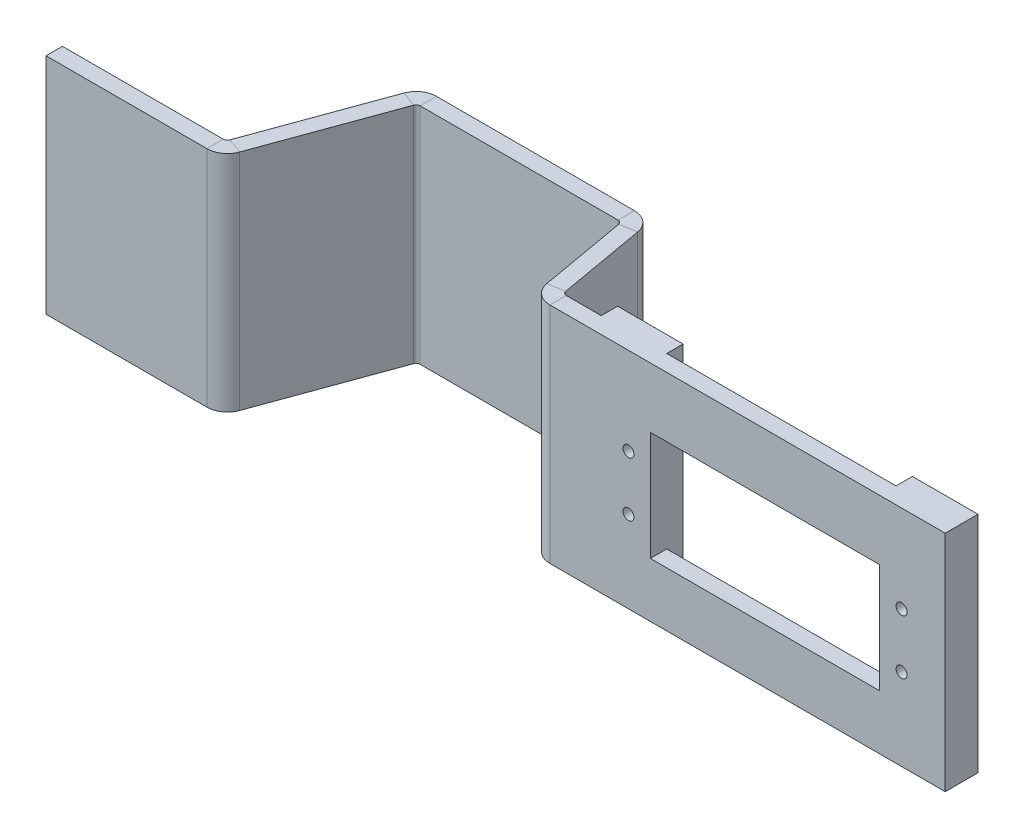
from build123d import *

# Parameters (mm, degrees)
BASE_FLANGE1_DEPTH  = 41
SKETCH2_W           = 42
SKETCH2_H           = 20
CUT_EXTRUDE1_DEPTH  = 10
BOSS_EXTRUDE1_DEPTH = 6
SKETCH5_R           = 1
CUT_EXTRUDE3_DEPTH  = 165.132308696


# Sheet-metal steps are written as plain solids
with BuildPart() as part:
    # Sketch1 → Base-Flange1 (new body)
    with BuildSketch(Plane(origin=(0, 0, 0), x_dir=(1, 0, 0), z_dir=(0, 1, 0))):
        with BuildLine():
            Line((0, 0), (29.484227127, 0))
            ThreePointArc((29.484227127, 0), (29.90672353, 0.133212604), (30.176404712, 0.484667962))
            Line((30.176404712, 0.484667962), (38.681704054, 23.85278585))
            ThreePointArc((38.681704054, 23.85278585), (40.049733788, 25.635636911), (42.1929595, 26.311393382))
            Line((42.1929595, 26.311393382), (78.441184331, 26.311393382))
            ThreePointArc((78.441184331, 26.311393382), (80.843024514, 25.437195048), (82.121016981, 23.223647163))
            Line((82.121016981, 23.223647163), (84.942198964, 7.223929074))
            ThreePointArc((84.942198964, 7.223929074), (85.194131001, 6.787569985), (85.667608355, 6.615238322))
            Line((85.667608355, 6.615238322), (158.049527566, 6.615238322))
            Line((158.049527566, 6.615238322), (158.049527566, 3.615238322))
            Line((158.049527566, 3.615238322), (85.667608355, 3.615238322))
            ThreePointArc((85.667608355, 3.615238322), (83.265768172, 4.489436656), (81.987775705, 6.702984541))
            Line((81.987775705, 6.702984541), (79.166593722, 22.70270263))
            ThreePointArc((79.166593722, 22.70270263), (78.914661685, 23.139061719), (78.441184331, 23.311393382))
            Line((78.441184331, 23.311393382), (42.1929595, 23.311393382))
            ThreePointArc((42.1929595, 23.311393382), (41.770463097, 23.178180778), (41.500781916, 22.82672542))
            Line((41.500781916, 22.82672542), (32.995482574, -0.541392468))
            ThreePointArc((32.995482574, -0.541392468), (31.627452839, -2.324243529), (29.484227127, -3))
            Line((29.484227127, -3), (0, -3))
            Line((0, -3), (0, 0))
        make_face()
    extrude(amount=BASE_FLANGE1_DEPTH)

    # Sketch2 → Cut-Extrude1 (cut)
    with BuildSketch(Plane.XY.offset(-3.615238322)):
        with Locations((125.049527566, 20)):
            Rectangle(SKETCH2_W, SKETCH2_H)
    extrude(amount=-CUT_EXTRUDE1_DEPTH, mode=Mode.SUBTRACT)

    # Sketch3 → Boss-Extrude1 (add)
    with BuildSketch(Plane.XY.offset(-3.615238322)):
        Polygon((104.049527566, 30), (104.049527566, 41), (92.049527566, 41), (92.049527566, 0), (104.049527566, 0), (104.049527566, 10), align=None)
        Polygon((158.049527566, 0), (158.049527566, 41), (146.049527566, 41), (146.049527566, 30), (146.049527566, 10), (146.049527566, 0), align=None)
    extrude(amount=-BOSS_EXTRUDE1_DEPTH)

    # Sketch5 → Cut-Extrude3 (cut, through all)
    with BuildSketch(Plane(origin=(0, 0, -9.615238322), x_dir=(-1, 0, 0), z_dir=(0, 0, -1))):
        with Locations((-100.049527566, 25)):
            Circle(SKETCH5_R)
        with Locations((-100.049527566, 15)):
            Circle(SKETCH5_R)
        with Locations((-150.049527566, 15)):
            Circle(SKETCH5_R)
        with Locations((-150.049527566, 25)):
            Circle(SKETCH5_R)
    extrude(amount=-CUT_EXTRUDE3_DEPTH, mode=Mode.SUBTRACT)


solid = part.part
